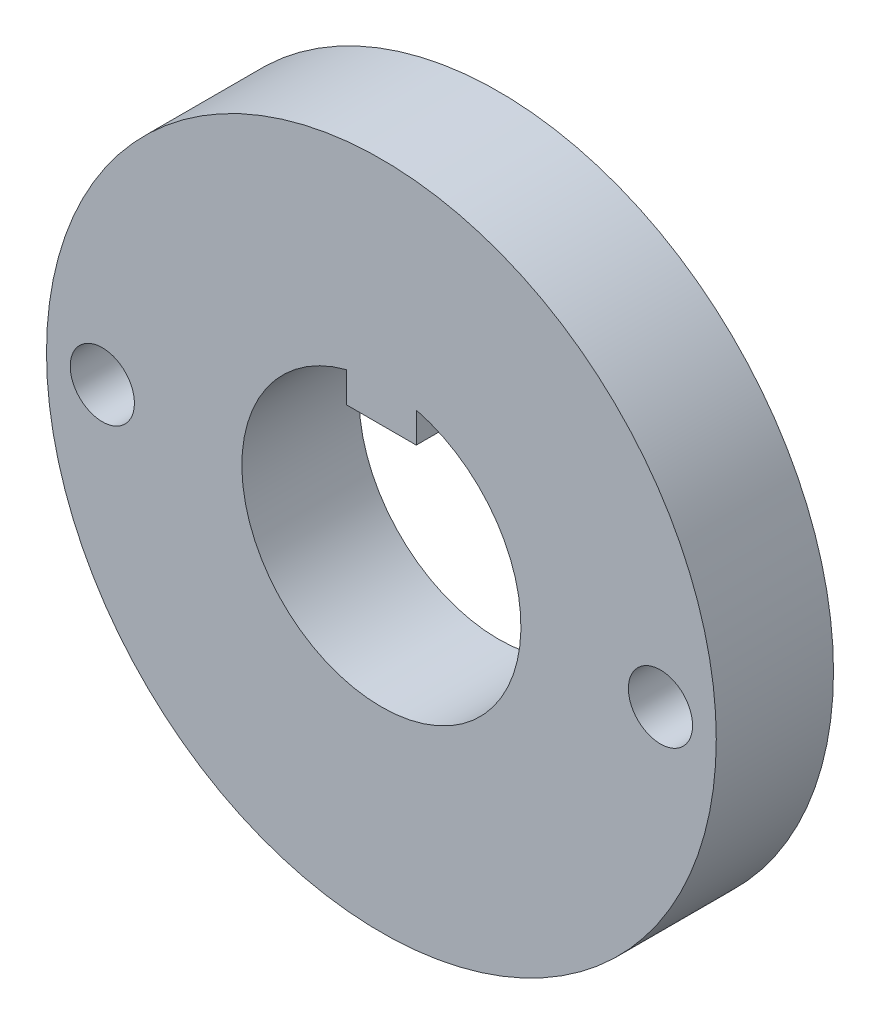
from build123d import *

# Parameters (mm, degrees)
SKETCH1_R                       = 15.24
SKETCH1_R_2                     = 9.144
BOSS_EXTRUDE1_DEPTH             = 2.667
SKETCH2_R                       = 1.4605
CUT_EXTRUDE1_DEPTH              = 23.202854681
BOSS_EXTRUDE2_REACH             = 23.717
SKETCH3_R                       = 9.525
BOSS_EXTRUDE2_DIRECTION_2_REACH = 23.717


with BuildPart() as part:
    # Sketch1 → Boss-Extrude1 (new, symmetric)
    with BuildSketch(Plane.XY):
        Circle(SKETCH1_R)
        Circle(SKETCH1_R_2, mode=Mode.SUBTRACT)
    extrude(amount=BOSS_EXTRUDE1_DEPTH, both=True)

    # Sketch2 → Cut-Extrude1 (cut, through all)
    with BuildSketch(Plane.XY.offset(2.667)):
        with Locations((12.7, 0)):
            Circle(SKETCH2_R)
        with Locations((-12.7, 0)):
            Circle(SKETCH2_R)
    extrude(amount=-CUT_EXTRUDE1_DEPTH, mode=Mode.SUBTRACT)

    # Boss-Extrude2: up to this face of the body (flat: up to its plane)
    boss_extrude2_end = Plane(part.part.faces().sort_by_distance((-14.808947706, 0, 2.667))[0])
    # Sketch3 → Boss-Extrude2 (add, up to the picked face)
    with BuildSketch(Plane.XY, mode=Mode.PRIVATE) as boss_extrude2_sk1:
        Circle(SKETCH3_R)
        with BuildLine():
            Line((-1.5875, 6.148361062), (-1.5875, 4.7625))
            Line((-1.5875, 4.7625), (1.5875, 4.7625))
            Line((1.5875, 4.7625), (1.5875, 6.148361062))
            ThreePointArc((1.5875, 6.148361062), (0, -6.35), (-1.5875, 6.148361062))
        make_face(mode=Mode.SUBTRACT)
    boss_extrude2_tool1 = split(extrude(boss_extrude2_sk1.sketch, amount=BOSS_EXTRUDE2_REACH, mode=Mode.PRIVATE), bisect_by=boss_extrude2_end, keep=Keep.BOTH, mode=Mode.PRIVATE)
    add(boss_extrude2_tool1.solids().sort_by(Axis((-9.255592, 0, 0), (0, 0, 1)))[0])

    # Boss-Extrude2 direction 2: up to this face of the body (flat: up to its plane)
    boss_extrude2_direction_2_end = Plane(part.part.faces().sort_by_distance((-14.808947706, 0, -2.667))[0])
    # Sketch3 → Boss-Extrude2 direction 2 (add, up to the picked face)
    with BuildSketch(Plane.XY, mode=Mode.PRIVATE) as boss_extrude2_direction_2_sk1:
        Circle(SKETCH3_R)
        with BuildLine():
            Line((-1.5875, 6.148361062), (-1.5875, 4.7625))
            Line((-1.5875, 4.7625), (1.5875, 4.7625))
            Line((1.5875, 4.7625), (1.5875, 6.148361062))
            ThreePointArc((1.5875, 6.148361062), (0, -6.35), (-1.5875, 6.148361062))
        make_face(mode=Mode.SUBTRACT)
    boss_extrude2_direction_2_tool1 = split(extrude(boss_extrude2_direction_2_sk1.sketch, amount=-BOSS_EXTRUDE2_DIRECTION_2_REACH, mode=Mode.PRIVATE), bisect_by=boss_extrude2_direction_2_end, keep=Keep.BOTH, mode=Mode.PRIVATE)
    add(boss_extrude2_direction_2_tool1.solids().sort_by(Axis((-9.255592, 0, 0), (0, 0, -1)))[0])


solid = part.part
